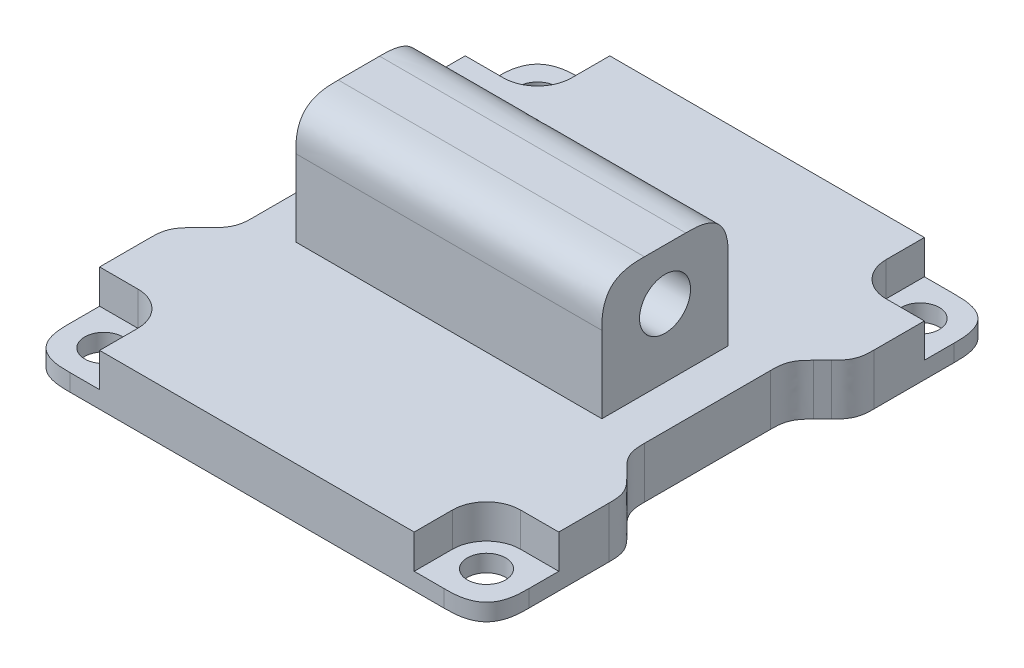
from build123d import *

# Parameters (mm, degrees)
SKETCH1_W                      = 54
SKETCH1_H                      = 60
BOSS_EXTRUDE1_DEPTH            = 6
CBORE_FOR_M4_SHCS1_D           = 4.5
CBORE_FOR_M4_SHCS1_DEPTH       = 12.4
CBORE_FOR_M4_SHCS1_CBORE_D     = 8
CBORE_FOR_M4_SHCS1_CBORE_DEPTH = 4
CBORE_FOR_M4_SHCS1_TIP         = 1.351936393
CUT_EXTRUDE1_DEPTH             = 4
FILLET1_SIZE                   = 5
CUT_EXTRUDE2_DEPTH             = 41.804411681
BOSS_EXTRUDE2_START            = -5
SKETCH6_W                      = 14.857864376
SKETCH6_H                      = 14
SKETCH6_R                      = 3
BOSS_EXTRUDE2_DEPTH            = 36
FILLET3_SIZE                   = 5


with BuildPart() as part:
    # Sketch1 → Boss-Extrude1 (new body)
    with BuildSketch(Plane(origin=(0, 0, 0), x_dir=(1, 0, 0), z_dir=(0, 1, 0))):
        Rectangle(SKETCH1_W, SKETCH1_H)
    extrude(amount=BOSS_EXTRUDE1_DEPTH)

    # CBORE for M4 SHCS1
    with Locations(Plane(origin=(0, 6, 0), x_dir=(1, 0, 0), z_dir=(0, 1, 0))):
        with Locations((-22.5, 25.5), (-22.5, -25.5), (22.5, -25.5), (22.5, 25.5)):
            CounterBoreHole(CBORE_FOR_M4_SHCS1_D / 2, CBORE_FOR_M4_SHCS1_CBORE_D / 2, CBORE_FOR_M4_SHCS1_CBORE_DEPTH, depth=CBORE_FOR_M4_SHCS1_DEPTH)
            with Locations((0, 0, -(CBORE_FOR_M4_SHCS1_DEPTH + CBORE_FOR_M4_SHCS1_TIP / 2))):  # 118° drill point
                Cone(0, CBORE_FOR_M4_SHCS1_D / 2, CBORE_FOR_M4_SHCS1_TIP, mode=Mode.SUBTRACT)

    # Sketch4 → Cut-Extrude1 (cut)
    with BuildSketch(Plane(origin=(0, 6, 0), x_dir=(1, 0, 0), z_dir=(0, 1, 0))):
        with BuildLine():
            Line((-22.5, 21.5), (-27, 21.5))
            Line((-27, 21.5), (-27, 30))
            Line((-27, 30), (-18.5, 30))
            Line((-18.5, 30), (-18.5, 25.5))
            ThreePointArc((-18.5, 25.5), (-19.671572875, 22.671572875), (-22.5, 21.5))
        make_face()
        with BuildLine():
            Line((22.5, 21.5), (27, 21.5))
            Line((27, 21.5), (27, 30))
            Line((27, 30), (18.5, 30))
            Line((18.5, 30), (18.5, 25.5))
            ThreePointArc((18.5, 25.5), (19.671572875, 22.671572875), (22.5, 21.5))
        make_face()
        with BuildLine():
            Line((18.5, -30), (18.5, -25.5))
            ThreePointArc((18.5, -25.5), (19.671572875, -22.671572875), (22.5, -21.5))
            Line((22.5, -21.5), (27, -21.5))
            Line((27, -21.5), (27, -30))
            Line((27, -30), (18.5, -30))
        make_face()
        with BuildLine():
            Line((-18.5, -30), (-18.5, -25.5))
            ThreePointArc((-18.5, -25.5), (-19.671572875, -22.671572875), (-22.5, -21.5))
            Line((-22.5, -21.5), (-27, -21.5))
            Line((-27, -21.5), (-27, -30))
            Line((-27, -30), (-18.5, -30))
        make_face()
    extrude(amount=-CUT_EXTRUDE1_DEPTH, mode=Mode.SUBTRACT)

    # Fillet1
    # a fillet whose section is not a circle: 5 mm, written as the material it takes off along each edge
    with BuildSketch(Plane(origin=(27, -12.5, -30), x_dir=(0, 0, 1), z_dir=(0, 1, 0)), Plane(origin=(27, -12.5, 30), x_dir=(-1, 0, 0), z_dir=(0, 1, 0))) as fillet1_piece_1:
        with BuildLine():
            add(Edge.make_bspline([(FILLET1_SIZE, 0), (FILLET1_SIZE * 0.831801948466, 0), (FILLET1_SIZE * 0.663603896932, 0), (FILLET1_SIZE * 0.292893218813, -FILLET1_SIZE * 0.0716919198361), (FILLET1_SIZE * 0.0716919198361, -FILLET1_SIZE * 0.292893218813), (0, -FILLET1_SIZE * 0.663603896932), (0, -FILLET1_SIZE * 0.831801948466), (0, -FILLET1_SIZE)], knots=[0, 0, 0, 0, 0, 0, 0.5, 0.5, 1, 1, 1, 1, 1, 1], degree=5))
            Line((0, -FILLET1_SIZE), (0, 0))
            Line((0, 0), (FILLET1_SIZE, 0))
        make_face()
    extrude(amount=27, mode=Mode.SUBTRACT)
    with BuildSketch(Plane(origin=(-27, -12.5, -30), x_dir=(0, 0, 1), z_dir=(0, 1, 0)), Plane(origin=(-27, -12.5, 30), x_dir=(1, 0, 0), z_dir=(0, 1, 0))) as fillet1_piece_2:
        with BuildLine():
            add(Edge.make_bspline([(FILLET1_SIZE, 0), (FILLET1_SIZE * 0.831801948466, 0), (FILLET1_SIZE * 0.663603896932, 0), (FILLET1_SIZE * 0.292893218813, FILLET1_SIZE * 0.0716919198361), (FILLET1_SIZE * 0.0716919198361, FILLET1_SIZE * 0.292893218813), (0, FILLET1_SIZE * 0.663603896932), (0, FILLET1_SIZE * 0.831801948466), (0, FILLET1_SIZE)], knots=[0, 0, 0, 0, 0, 0, 0.5, 0.5, 1, 1, 1, 1, 1, 1], degree=5))
            Line((0, FILLET1_SIZE), (0, 0))
            Line((0, 0), (FILLET1_SIZE, 0))
        make_face()
    extrude(amount=27, mode=Mode.SUBTRACT)

    # Sketch5 → Cut-Extrude2 (cut, through all)
    with BuildSketch(Plane(origin=(0, 6, 0), x_dir=(1, 0, 0), z_dir=(0, 1, 0))):
        Polygon((-27, 13.5), (-23, 9.5), (-23, -9.5), (-27, -13.5), align=None)
        Polygon((27, 13.5), (23, 9.5), (23, -9.5), (27, -13.5), align=None)
    extrude(amount=-CUT_EXTRUDE2_DEPTH, mode=Mode.SUBTRACT)

    # Fillet2
    # a fillet whose section is not a circle: 5 mm, written as the material it adds along each edge
    with BuildSketch(Plane(origin=(-23, 6, 9.5), x_dir=(-0.7071067811865389, 0, 0.7071067811865561), z_dir=(0, -1, 0)), Plane(origin=(23, 6, 9.5), x_dir=(0, 0, -1), z_dir=(0, -1, 0)), Plane(origin=(23, 6, -9.5), x_dir=(0.707106781186557, 0, -0.7071067811865381), z_dir=(0, -1, 0)), Plane(origin=(-23, 6, -9.5), x_dir=(0, 0, 1), z_dir=(0, -1, 0))) as fillet2_piece_1:
        with BuildLine():
            add(Edge.make_bspline([(2.071067812, 0), (1.691961313, 0), (1.312854813, 0), (0.467093497, 0.07115949), (-0.279967621, 0.380602337), (-0.928328541, 0.928328541), (-1.196397318, 1.196397318), (-1.464466094, 1.464466094)], knots=[0, 0, 0, 0, 0, 0, 0.5, 0.5, 1, 1, 1, 1, 1, 1], degree=5))
            Line((-1.464466094, 1.464466094), (0, 0))
            Line((0, 0), (2.071067812, 0))
        make_face()
    extrude(amount=6)
    # a fillet whose section is not a circle: 5 mm, written as the material it takes off along each edge
    with BuildSketch(Plane(origin=(27, 11.17766953, 13.5), x_dir=(-0.7071067811865385, 0, -0.7071067811865565), z_dir=(0, -1, 0)), Plane(origin=(27, 11.17766953, -13.5), x_dir=(0, 0, -1), z_dir=(0, -1, 0)), Plane(origin=(-27, 11.17766953, 13.5), x_dir=(0, 0, 1), z_dir=(0, -1, 0)), Plane(origin=(-27, 11.17766953, -13.5), x_dir=(0.7071067811865569, 0, 0.707106781186538), z_dir=(0, -1, 0))) as fillet2_2_piece_1:
        with BuildLine():
            add(Edge.make_bspline([(2.071067812, 0), (1.691961313, 0), (1.312854813, 0), (0.467093497, -0.07115949), (-0.279967621, -0.380602337), (-0.928328541, -0.928328541), (-1.196397318, -1.196397318), (-1.464466094, -1.464466094)], knots=[0, 0, 0, 0, 0, 0, 0.5, 0.5, 1, 1, 1, 1, 1, 1], degree=5))
            Line((-1.464466094, -1.464466094), (0, 0))
            Line((0, 0), (2.071067812, 0))
        make_face()
    extrude(amount=16.355339059, mode=Mode.SUBTRACT)

    # Sketch6 → Boss-Extrude2 (add)
    with BuildSketch(Plane.ZY.offset(23).offset(BOSS_EXTRUDE2_START)):
        with Locations((0, 13)):
            Rectangle(SKETCH6_W, SKETCH6_H)
        with Locations((0, 14)):
            Circle(SKETCH6_R, mode=Mode.SUBTRACT)
    extrude(amount=-BOSS_EXTRUDE2_DEPTH)

    # Fillet3
    # a fillet whose section is not a circle: 5 mm, written as the material it takes off along each edge
    with BuildSketch(Plane(origin=(-30.5, 20, -7.428932188), x_dir=(0, -1, 0), z_dir=(1, 0, 0))) as fillet3_piece_1:
        with BuildLine():
            add(Edge.make_bspline([(FILLET3_SIZE, 0), (FILLET3_SIZE * 0.831801948466, 0), (FILLET3_SIZE * 0.663603896932, 0), (FILLET3_SIZE * 0.292893218813, -FILLET3_SIZE * 0.0716919198361), (FILLET3_SIZE * 0.0716919198361, -FILLET3_SIZE * 0.292893218813), (0, -FILLET3_SIZE * 0.663603896932), (0, -FILLET3_SIZE * 0.831801948466), (0, -FILLET3_SIZE)], knots=[0, 0, 0, 0, 0, 0, 0.5, 0.5, 1, 1, 1, 1, 1, 1], degree=5))
            Line((0, -FILLET3_SIZE), (0, 0))
            Line((0, 0), (FILLET3_SIZE, 0))
        make_face()
    extrude(amount=61, mode=Mode.SUBTRACT)
    with BuildSketch(Plane(origin=(-30.5, 20, 7.428932188), x_dir=(0, -1, 0), z_dir=(1, 0, 0))) as fillet3_piece_2:
        with BuildLine():
            add(Edge.make_bspline([(FILLET3_SIZE, 0), (FILLET3_SIZE * 0.831801948466, 0), (FILLET3_SIZE * 0.663603896932, 0), (FILLET3_SIZE * 0.292893218813, FILLET3_SIZE * 0.0716919198361), (FILLET3_SIZE * 0.0716919198361, FILLET3_SIZE * 0.292893218813), (0, FILLET3_SIZE * 0.663603896932), (0, FILLET3_SIZE * 0.831801948466), (0, FILLET3_SIZE)], knots=[0, 0, 0, 0, 0, 0, 0.5, 0.5, 1, 1, 1, 1, 1, 1], degree=5))
            Line((0, FILLET3_SIZE), (0, 0))
            Line((0, 0), (FILLET3_SIZE, 0))
        make_face()
    extrude(amount=61, mode=Mode.SUBTRACT)


solid = part.part
